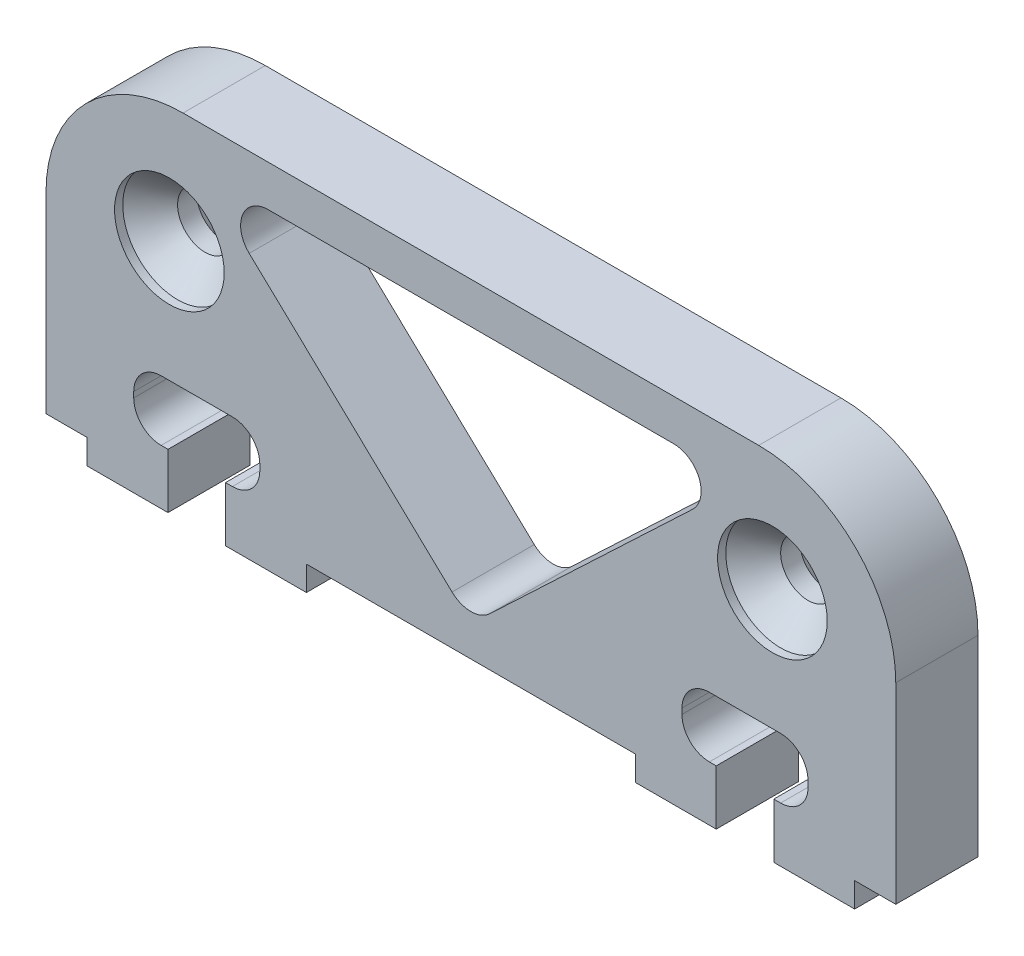
from build123d import *

# Parameters (mm, degrees)
BASE_SHAPE_DEPTH                               = 3
EDGE_RADIUSES_R                                = 5
CAMERA_MOUNT_POCKETS_DEPTH                     = 1
CAMERA_MOUNT_HOLES_REACH                       = 19.084
SKETCH3_R                                      = 1
CSK_FOR_M2_FLAT_HEAD_MACHINE_SCREW1_AT_2_COUNT = 2
CSK_FOR_M2_FLAT_HEAD_MACHINE_SCREW1_AT_2_PITCH = 22
CUT_EXTRUDE3_REACH                             = 19.23
F_1MM_MILLING_RADIUSES_R                       = 1


with BuildPart() as part:
    # Sketch1 → Base shape (new body)
    with BuildSketch(Plane.XY):
        Polygon((15.5, 6), (-15.5, 6), (-15.5, -6), (-14, -6), (-14, -6.9), (-11.05, -6.9), (-11.05, -4.9), (-12.3, -4.9), (-12.3, -2.7), (-7.7, -2.7), (-7.7, -4.9), (-8.95, -4.9), (-8.95, -6.9), (-6, -6.9), (-6, -6), (6, -6), (6, -6.9), (8.95, -6.9), (8.95, -4.9), (7.7, -4.9), (7.7, -2.7), (12.3, -2.7), (12.3, -4.9), (11.05, -4.9), (11.05, -6.9), (14, -6.9), (14, -6), (15.5, -6), align=None)
    extrude(amount=BASE_SHAPE_DEPTH)

    # Edge radiuses
    edge_radiuses_edges = [part.edges().sort_by_distance(p)[0] for p in [
        (15.5, 6, 1.5),
        (-15.5, 6, 1.5),
    ]]
    fillet(edge_radiuses_edges, radius=EDGE_RADIUSES_R)

    # Sketch2 → Camera mount pockets (cut)
    with BuildSketch(Plane(origin=(0, 0, 0), x_dir=(-1, 0, 0), z_dir=(0, 0, -1))):
        with BuildLine():
            Line((-11.1, 5.1), (-10.9, 5.1))
            ThreePointArc((-10.9, 5.1), (-10.192893219, 4.807106781), (-9.9, 4.1))
            Line((-9.9, 4.1), (-9.9, -0.7))
            ThreePointArc((-9.9, -0.7), (-10.192893219, -1.407106781), (-10.9, -1.7))
            Line((-10.9, -1.7), (-11.1, -1.7))
            ThreePointArc((-11.1, -1.7), (-11.807106781, -1.407106781), (-12.1, -0.7))
            Line((-12.1, -0.7), (-12.1, 4.1))
            ThreePointArc((-12.1, 4.1), (-11.807106781, 4.807106781), (-11.1, 5.1))
        make_face()
        with BuildLine():
            Line((11.1, 5.1), (10.9, 5.1))
            ThreePointArc((10.9, 5.1), (10.192893219, 4.807106781), (9.9, 4.1))
            Line((9.9, 4.1), (9.9, -0.7))
            ThreePointArc((9.9, -0.7), (10.192893219, -1.407106781), (10.9, -1.7))
            Line((10.9, -1.7), (11.1, -1.7))
            ThreePointArc((11.1, -1.7), (11.807106781, -1.407106781), (12.1, -0.7))
            Line((12.1, -0.7), (12.1, 4.1))
            ThreePointArc((12.1, 4.1), (11.807106781, 4.807106781), (11.1, 5.1))
        make_face()
    extrude(amount=-CAMERA_MOUNT_POCKETS_DEPTH, mode=Mode.SUBTRACT)

    # Sketch3 → Camera mount holes (cut, up to next)
    with BuildSketch(Plane(origin=(0, 0, 1), x_dir=(-1, 0, 0), z_dir=(0, 0, -1)), mode=Mode.PRIVATE) as camera_mount_holes_sk1:
        with Locations((-11, 1.7)):
            Circle(SKETCH3_R)
    camera_mount_holes_tool1 = extrude(camera_mount_holes_sk1.sketch, amount=-CAMERA_MOUNT_HOLES_REACH, mode=Mode.PRIVATE) & part.part
    # Sketch3 → Camera mount holes (cut, up to next)
    with BuildSketch(Plane(origin=(0, 0, 1), x_dir=(-1, 0, 0), z_dir=(0, 0, -1)), mode=Mode.PRIVATE) as camera_mount_holes_sk2:
        with Locations((11, 1.7)):
            Circle(SKETCH3_R)
    camera_mount_holes_tool2 = extrude(camera_mount_holes_sk2.sketch, amount=-CAMERA_MOUNT_HOLES_REACH, mode=Mode.PRIVATE) & part.part
    add(camera_mount_holes_tool1.solids().sort_by_distance((11, 1.7, 1))[0], mode=Mode.SUBTRACT)
    add(camera_mount_holes_tool2.solids().sort_by_distance((-11, 1.7, 1))[0], mode=Mode.SUBTRACT)

    # Sketch5 → CSK for M2 Flat Head Machine Screw1 (revolve, cut)
    with BuildSketch(Plane(origin=(-11, 1.7, 3), x_dir=(0, -1, 0), z_dir=(1, 0, 0))):
        Polygon((0, 0), (0, 3), (1, 3), (1, 1.3), (2, 0.3), (2, 0), align=None)
    csk_for_m2_flat_head_machine_screw1 = revolve(axis=Axis((-11, 1.7, 9.35), (0, 0, -1)), mode=Mode.SUBTRACT)

    # CSK for M2 Flat Head Machine Screw1 at 2: CSK for M2 Flat Head Machine Screw1 ×2
    with Locations(*[(i * CSK_FOR_M2_FLAT_HEAD_MACHINE_SCREW1_AT_2_PITCH, 0, 0) for i in range(1, CSK_FOR_M2_FLAT_HEAD_MACHINE_SCREW1_AT_2_COUNT)]):
        add(csk_for_m2_flat_head_machine_screw1, mode=Mode.SUBTRACT)

    # Sketch6 → Cut-Extrude3 (cut, up to next)
    with BuildSketch(Plane(origin=(0, 0, 0), x_dir=(-1, 0, 0), z_dir=(0, 0, -1)), mode=Mode.PRIVATE) as cut_extrude3_sk1:
        with BuildLine():
            Line((7.4, 4.5), (-7.400000002, 4.5))
            ThreePointArc((-7.400000002, 4.5), (-8.329103982, 3.869818592), (-8.087199854, 2.773531583))
            Line((-8.087199854, 2.773531583), (-0.687199854, -4.226468417))
            ThreePointArc((-0.687199854, -4.226468417), (0, -4.5), (0.687199854, -4.226468417))
            Line((0.687199854, -4.226468417), (8.087199854, 2.773531583))
            ThreePointArc((8.087199854, 2.773531583), (8.329103982, 3.869818593), (7.4, 4.5))
        make_face()
    cut_extrude3_tool1 = extrude(cut_extrude3_sk1.sketch, amount=-CUT_EXTRUDE3_REACH, mode=Mode.PRIVATE) & part.part
    add(cut_extrude3_tool1.solids().sort_by_distance((0, 1.308624, 0))[0], mode=Mode.SUBTRACT)

    # 1mm milling radiuses
    f_1mm_milling_radiuses_edges = [part.edges().sort_by_distance(p)[0] for p in [
        (-7.7, -2.7, 1.5),
        (-7.7, -4.9, 1.5),
        (12.3, -4.9, 1.5),
        (12.3, -2.7, 1.5),
        (7.7, -2.7, 1.5),
        (7.7, -4.9, 1.5),
        (-12.3, -4.9, 1.5),
        (-12.3, -2.7, 1.5),
    ]]
    fillet(f_1mm_milling_radiuses_edges, radius=F_1MM_MILLING_RADIUSES_R)


solid = part.part
